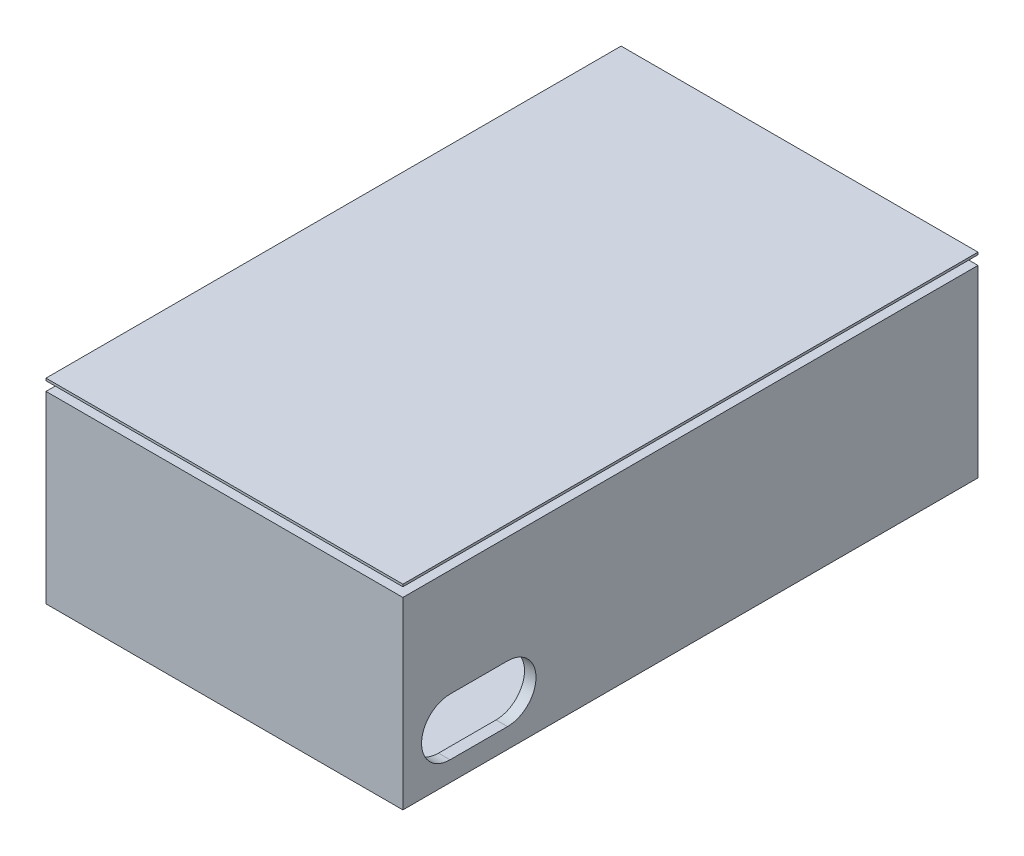
from build123d import *

# Parameters (mm, degrees)
SKETCH3_W             = 76.274754771
SKETCH3_H             = 40.702671828
BOSS_EXTRUDE2_DEPTH   = 127
SHELL1_T              = -2.54
SKETCH5_W             = 127
SKETCH5_H             = 40.702671828
BOSS_EXTRUDE6_DEPTH   = 2.54
SKETCH12_W            = 24.638
SKETCH12_H            = 26.67
BOSS_EXTRUDE8_DEPTH   = 6.604
BOSS_EXTRUDE8_2_DEPTH = 6.604
SKETCH15_R            = 1.5
SKETCH15_R_2          = 1.524
CUT_EXTRUDE7_DEPTH    = 2.54
FILLET4_R             = 2.54
FILLET5_R             = 2.54
FILLET7_R             = 0.75
CUT_EXTRUDE8_DEPTH    = 2.54
SKETCH26_W            = 78.814754771
SKETCH26_H            = 127
BOSS_EXTRUDE9_DEPTH   = 2.54
CUT_EXTRUDE12_START   = -2.54
SKETCH26_7_W          = 78.814754771
SKETCH26_7_H          = 127
CUT_EXTRUDE12_DEPTH   = 2.032
SKETCH31_W            = 73.734754771
SKETCH31_H            = 121.92
BOSS_EXTRUDE10_DEPTH  = 2.032
FILLET12_R            = 1.5
FILLET13_START        = -26.874187053
FILLET13_DEPTH        = 73.820959308
FILLET13_START_2      = 1.0399999
FILLET13_2_DEPTH      = 124.9200002
SKETCH11_W            = 71.12
SKETCH11_H            = 26
CUT_EXTRUDE13_DEPTH   = 2.54
FILLET14_R            = 0.5


with BuildPart() as part:
    # Sketch3 → Boss-Extrude2 (new body)
    with BuildSketch(Plane.XY):
        with Locations((8.766292601, 29.576142827)):
            Rectangle(SKETCH3_W, SKETCH3_H)
    extrude(amount=BOSS_EXTRUDE2_DEPTH)

    # Shell1
    shell1_openings = [part.faces().sort_by_distance(p)[0] for p in [
        (8.766292601, 49.927478741, 63.5),
        (46.903669986, 29.576142827, 63.5),
    ]]
    offset(amount=SHELL1_T, openings=shell1_openings, kind=Kind.INTERSECTION)

    # Sketch5 → Boss-Extrude6 (add)
    with BuildSketch(Plane(origin=(46.903669986, 0, 0), x_dir=(0, 0, -1), z_dir=(1, 0, 0))):
        with Locations((-63.5, 29.576142827)):
            Rectangle(SKETCH5_W, SKETCH5_H)
    extrude(amount=BOSS_EXTRUDE6_DEPTH)

    # Sketch15 → Cut-Extrude7 (cut)
    with BuildSketch(Plane.ZY.offset(29.371084785)):
        with Locations((101.468, 45.044142827)):
            Circle(SKETCH15_R)
        with Locations((101.536185385, 14.039957442)):
            Circle(SKETCH15_R)
        with Locations((25.532, 45.044142827)):
            Circle(SKETCH15_R_2)
        with Locations((25.532, 14.108142827)):
            Circle(SKETCH15_R_2)
    extrude(amount=-CUT_EXTRUDE7_DEPTH, mode=Mode.SUBTRACT)

    # Fillet7
    fillet7_edges = [part.edges().sort_by_distance(p)[0] for p in [
        (-26.831084785, 49.927478741, 63.5),
        (10.036292601, 49.927478741, 2.54),
        (10.036292601, 49.927478741, 124.46),
        (46.903669986, 49.927478741, 63.5),
    ]]
    fillet(fillet7_edges, radius=FILLET7_R)

    # Sketch6 → Cut-Extrude8 (cut)
    with BuildSketch(Plane(origin=(49.443669986, 0.547229788, -2.723397162), x_dir=(0, 0, -1), z_dir=(1, 0, 0))):
        with BuildLine():
            Line((-119.319419188, 25.626017745), (-106.614290816, 25.626017745))
            ThreePointArc((-106.614290816, 25.626017745), (-100.333849188, 19.345576117), (-106.614290816, 13.065134489))
            Line((-106.614290816, 13.065134489), (-119.319419188, 13.065134489))
            ThreePointArc((-119.319419188, 13.065134489), (-125.599860816, 19.345576117), (-119.319419188, 25.626017745))
        make_face()
    extrude(amount=-CUT_EXTRUDE8_DEPTH, mode=Mode.SUBTRACT)


with BuildPart() as body_2:
    # Sketch12 → Boss-Extrude8 (new body)
    with BuildSketch(Plane(origin=(0, 9.224806913, 0), x_dir=(-1, 0, 0), z_dir=(0, -1, 0))):
        with Locations((-10.036292601, -44.45)):
            Rectangle(SKETCH12_W, SKETCH12_H)
    extrude(amount=BOSS_EXTRUDE8_DEPTH)

    # Fillet4
    fillet4_edges = [body_2.edges().sort_by_distance(p)[0] for p in [
        (10.036292601, 2.620806913, 57.785),
        (-2.282707399, 2.620806913, 44.45),
        (10.036292601, 2.620806913, 31.115),
        (22.355292601, 2.620806913, 44.45),
    ]]
    fillet(fillet4_edges, radius=FILLET4_R)


with BuildPart() as body_3:
    # Sketch12 → Boss-Extrude8 2 (new body)
    with BuildSketch(Plane(origin=(0, 9.224806913, 0), x_dir=(-1, 0, 0), z_dir=(0, -1, 0))):
        with Locations((-10.036292601, -82.55)):
            Rectangle(SKETCH12_W, SKETCH12_H)
    extrude(amount=BOSS_EXTRUDE8_2_DEPTH)

    # Fillet5
    fillet5_edges = [body_3.edges().sort_by_distance(p)[0] for p in [
        (10.036292601, 2.620806913, 69.215),
        (22.355292601, 2.620806913, 82.55),
        (10.036292601, 2.620806913, 95.885),
        (-2.282707399, 2.620806913, 82.55),
    ]]
    fillet(fillet5_edges, radius=FILLET5_R)


with BuildPart() as body_4:
    # Sketch26 → Boss-Extrude9 (new body)
    with BuildSketch(Plane(origin=(0, 52.404806913, 0), x_dir=(1, 0, 0), z_dir=(0, 1, 0))):
        with Locations((10.036292601, -63.5)):
            Rectangle(SKETCH26_W, SKETCH26_H)
    extrude(amount=-BOSS_EXTRUDE9_DEPTH)


with BuildPart() as cut_extrude12_tool:
    # Sketch26<7> → Cut-Extrude12 (new body)
    with BuildSketch(Plane(origin=(0, 52.404806913, 0), x_dir=(1, 0, 0), z_dir=(0, 1, 0)).offset(CUT_EXTRUDE12_START)):
        with Locations((10.036292601, -63.5)):
            Rectangle(SKETCH26_7_W, SKETCH26_7_H)
    extrude(amount=CUT_EXTRUDE12_DEPTH)


with BuildPart() as part_1:
    add(part.part)

    # Cut-Extrude12: cut by cut_extrude12_tool
    add(cut_extrude12_tool.part, mode=Mode.SUBTRACT)

    # Sketch11 → Cut-Extrude13 (cut)
    with BuildSketch(Plane.ZY.offset(29.371084785)):
        with Locations((63.5, 29.576142827)):
            Rectangle(SKETCH11_W, SKETCH11_H)
    extrude(amount=-CUT_EXTRUDE13_DEPTH, mode=Mode.SUBTRACT)

    # Fillet14
    fillet14_edges = [part_1.edges().sort_by_distance(p)[0] for p in [
        (-26.831084785, 29.576142827, 27.94),
        (-26.831084785, 42.576142827, 63.5),
        (-26.831084785, 29.576142827, 99.06),
        (-26.831084785, 16.576142827, 63.5),
    ]]
    fillet(fillet14_edges, radius=FILLET14_R)


with BuildPart() as body_4_1:
    add(body_4.part)

    # Cut-Extrude12: cut by cut_extrude12_tool
    add(cut_extrude12_tool.part, mode=Mode.SUBTRACT)

    # Sketch31 → Boss-Extrude10 (add)
    with BuildSketch(Plane(origin=(0, 52.404806913, 0), x_dir=(1, 0, 0), z_dir=(0, 1, 0))):
        with Locations((10.036292601, -63.5)):
            Rectangle(SKETCH31_W, SKETCH31_H)
    extrude(amount=-BOSS_EXTRUDE10_DEPTH)

    # Fillet12
    fillet12_edges = [body_4_1.edges().sort_by_distance(p)[0] for p in [
        (10.036292601, 51.896806913, 124.46),
        (46.903669986, 51.896806913, 63.5),
        (10.036292601, 51.896806913, 2.54),
        (-26.831084785, 51.896806913, 63.5),
    ]]
    fillet(fillet12_edges, radius=FILLET12_R)

    # Fillet13: read off the stored shape, not the designer's step
    # Fillet13 outline → Fillet13 (cut)
    with BuildSketch(Plane.YZ.offset(FILLET13_START)):
        with BuildLine():
            ThreePointArc((50.753806913, 2.496897731), (50.479424147, 2.673904321), (50.372806913, 2.982530309))
            Line((50.372806913, 2.982530309), (50.372806913, 2.54))
            Line((50.372806913, 2.54), (50.396806913, 2.54))
            ThreePointArc((50.396806913, 2.54), (50.57660319, 2.529185448), (50.753806913, 2.496897731))
        make_face()
        with BuildLine():
            ThreePointArc((50.372806913, 124.017469691), (50.479424147, 124.326095679), (50.753806913, 124.503102269))
            ThreePointArc((50.753806913, 124.503102269), (50.57660319, 124.470814552), (50.396806913, 124.46))
            Line((50.396806913, 124.46), (50.372806913, 124.46))
            Line((50.372806913, 124.46), (50.372806913, 124.017469691))
        make_face()
    extrude(amount=FILLET13_DEPTH, mode=Mode.SUBTRACT)

    # Fillet13 2 outline → Fillet13 2 (cut)
    with BuildSketch(Plane.XY.offset(FILLET13_START_2)):
        with BuildLine():
            ThreePointArc((46.946772255, 50.753806913), (46.769765665, 50.479424147), (46.461139678, 50.372806913))
            Line((46.461139678, 50.372806913), (46.903669986, 50.372806913))
            Line((46.903669986, 50.372806913), (46.903669986, 50.396806913))
            ThreePointArc((46.903669986, 50.396806913), (46.914484538, 50.57660319), (46.946772255, 50.753806913))
        make_face()
        with BuildLine():
            ThreePointArc((-26.388554476, 50.372806913), (-26.697180463, 50.479424147), (-26.874187053, 50.753806913))
            ThreePointArc((-26.874187053, 50.753806913), (-26.841899337, 50.57660319), (-26.831084785, 50.396806913))
            Line((-26.831084785, 50.396806913), (-26.831084785, 50.372806913))
            Line((-26.831084785, 50.372806913), (-26.388554476, 50.372806913))
        make_face()
    extrude(amount=FILLET13_2_DEPTH, mode=Mode.SUBTRACT)


solid = Compound([body_2.part, body_3.part, part_1.part, body_4_1.part])
